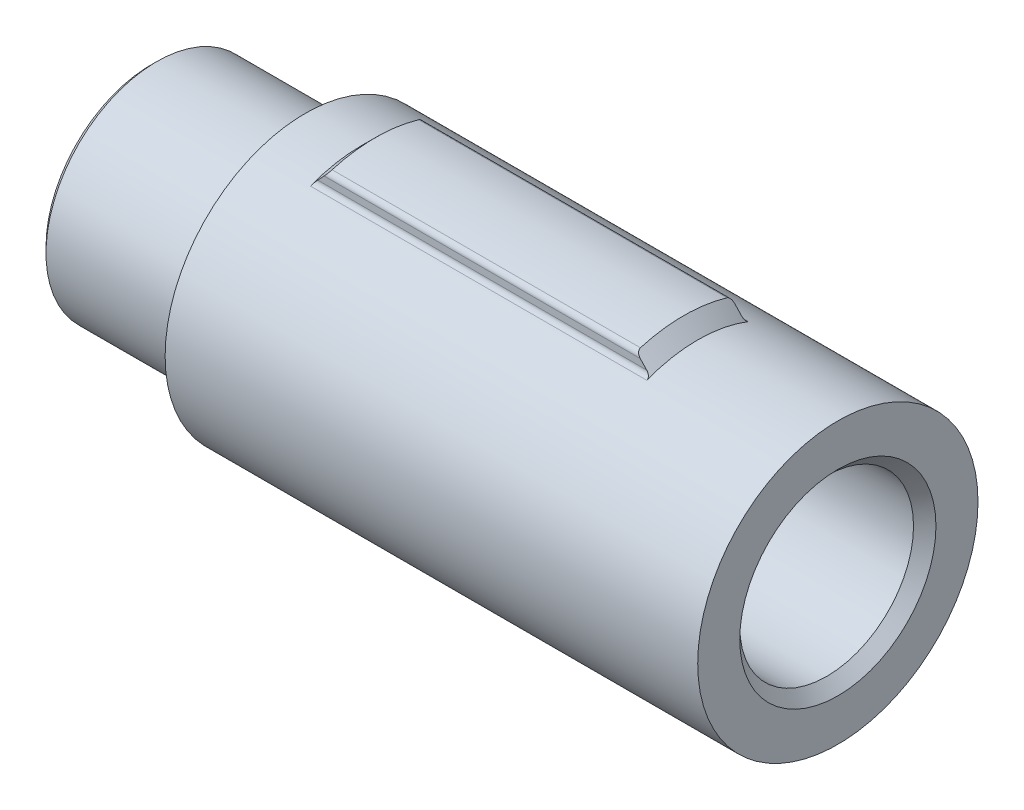
from build123d import *

# Parameters (mm, degrees)
SKETCH_1_R          = 5
EXTRUDE_1_DEPTH     = 19
SKETCH_3_R          = 3.1
CUT_EXTRUDE_1_DEPTH = 17
EXTRUDE_2_DEPTH     = 12
SKETCH_8_R          = 3.95
EXTRUDE_4_DEPTH     = 5.5
SKETCH_9_R          = 2.725
CUT_EXTRUDE_2_DEPTH = 5.5
EXTRUDE_5_DEPTH     = 4
FILLET_1_R          = 0.2
CHAMFER_1_SIZE      = 0.5
CHAMFER_2_SIZE      = 0.4
CHAMFER_3_SIZE      = 0.2


with BuildPart() as part:
    # 草图1 → 凸台-拉伸1 (new body)
    with BuildSketch(Plane(origin=(0, 0, 0), x_dir=(0, 0, -1), z_dir=(1, 0, 0))):
        Circle(SKETCH_1_R)
    extrude(amount=EXTRUDE_1_DEPTH)

    # 草图3 → 切除-拉伸1 (cut)
    with BuildSketch(Plane(origin=(19, 0, 0), x_dir=(0, 0, -1), z_dir=(1, 0, 0))):
        Circle(SKETCH_3_R)
    extrude(amount=-CUT_EXTRUDE_1_DEPTH, mode=Mode.SUBTRACT)

    # 草图5 → 凸台-拉伸2 (add)
    with BuildSketch(Plane(origin=(2, 0, 0), x_dir=(0, 0, -1), z_dir=(1, 0, 0))):
        with BuildLine():
            Line((-1.688194302, 2.6), (1.688194302, 2.6))
            Line((1.688194302, 2.6), (1.688194302, 5.234500931))
            ThreePointArc((1.688194302, 5.234500931), (0, 5.5), (-1.688194302, 5.234500931))
            Line((-1.688194302, 5.234500931), (-1.688194302, 2.6))
        make_face()
    extrude(amount=EXTRUDE_2_DEPTH)

    # 草图8 → 凸台-拉伸4 (add)
    with BuildSketch(Plane.ZY):
        Circle(SKETCH_8_R)
    extrude(amount=EXTRUDE_4_DEPTH)

    # 草图9 → 切除-拉伸2 (cut)
    with BuildSketch(Plane.ZY.offset(5.5)):
        Circle(SKETCH_9_R)
    extrude(amount=-CUT_EXTRUDE_2_DEPTH, mode=Mode.SUBTRACT)

    # 草图10 → 凸台-拉伸5 (add)
    with BuildSketch(Plane.ZY):
        Polygon((0.721687836, 1.25), (-0.721687836, 1.25), (-1.443375673, 0), (-0.721687836, -1.25), (0.721687836, -1.25), (1.443375673, 0), align=None)
    extrude(amount=EXTRUDE_5_DEPTH)

    # 圆角1
    fillet_1_edges = [part.edges().sort_by_distance(p)[0] for p in [
        (8, 4.70637865, 1.688194302),
        (8, 5.234500931, 1.688194302),
        (8, 4.70637865, -1.688194302),
        (8, 5.234500931, -1.688194302),
    ]]
    fillet(fillet_1_edges, radius=FILLET_1_R)

    # 倒角1
    # the kernel refuses this chamfer: 0.5 mm, written as the material it takes off along each edge
    with BuildSketch(Plane(origin=(14, 0, 0), x_dir=(0, 0.8686030413593419, -0.4955085837211114), z_dir=(0, -0.4955085837211114, -0.8686030413593419))) as chamfer_1_piece_1:
        Polygon((5.5, -CHAMFER_1_SIZE), (5.5 - CHAMFER_1_SIZE, 0), (5.5, 0), align=None)
    revolve(axis=Axis((14, 0, 0), (1, 0, 0)), revolution_arc=59.40658503, mode=Mode.SUBTRACT)
    with BuildSketch(Plane(origin=(2, 0, 0), x_dir=(0, 0.8686030413593415, -0.4955085837211117), z_dir=(0, -0.4955085837211117, -0.8686030413593415))) as chamfer_1_piece_2:
        Polygon((5.5 - CHAMFER_1_SIZE, 0), (5.5, CHAMFER_1_SIZE), (5.5, 0), align=None)
    revolve(axis=Axis((2, 0, 0), (1, 0, 0)), revolution_arc=59.40658503, mode=Mode.SUBTRACT)
    with BuildSketch(Plane(origin=(14, 2.6, 2.974035796), x_dir=(0.027495876610585623, 0.9996219169112968, 0), z_dir=(0, 0, -1))) as chamfer_1_piece_3_section:
        Polygon((CHAMFER_1_SIZE * 0.999621916911, -CHAMFER_1_SIZE * 0.0274958766106), (-CHAMFER_1_SIZE * 0.0274958766106, -CHAMFER_1_SIZE * 0.999621916911), (0, 0), align=None)
    chamfer_1_piece_3 = extrude(amount=5.948071591, mode=Mode.PRIVATE)
    chamfer_1_piece_3 = chamfer_1_piece_3 & Plane(origin=(13.821912141, 0, 0), x_dir=(0, 0, -1), z_dir=(1, 0, 0)) * Cylinder(3.1, 14, mode=Mode.PRIVATE)
    add(chamfer_1_piece_3, mode=Mode.SUBTRACT)

    # 倒角2
    chamfer_2_edges = [part.edges().sort_by_distance(p)[0] for p in [
        (19, 0, 3.1),
    ]]
    chamfer(chamfer_2_edges, length=CHAMFER_2_SIZE)

    # 倒角3
    chamfer_3_edges = [part.edges().sort_by_distance(p)[0] for p in [
        (-5.5, 0, -3.95),
        (-5.5, 0, -2.725),
        (-4, 0.625, 1.082531755),
        (-4, 1.25, 0),
        (-4, 0.625, -1.082531755),
        (-4, -0.625, -1.082531755),
        (-4, -1.25, 0),
        (-4, -0.625, 1.082531755),
    ]]
    chamfer(chamfer_3_edges, length=CHAMFER_3_SIZE)


solid = part.part
